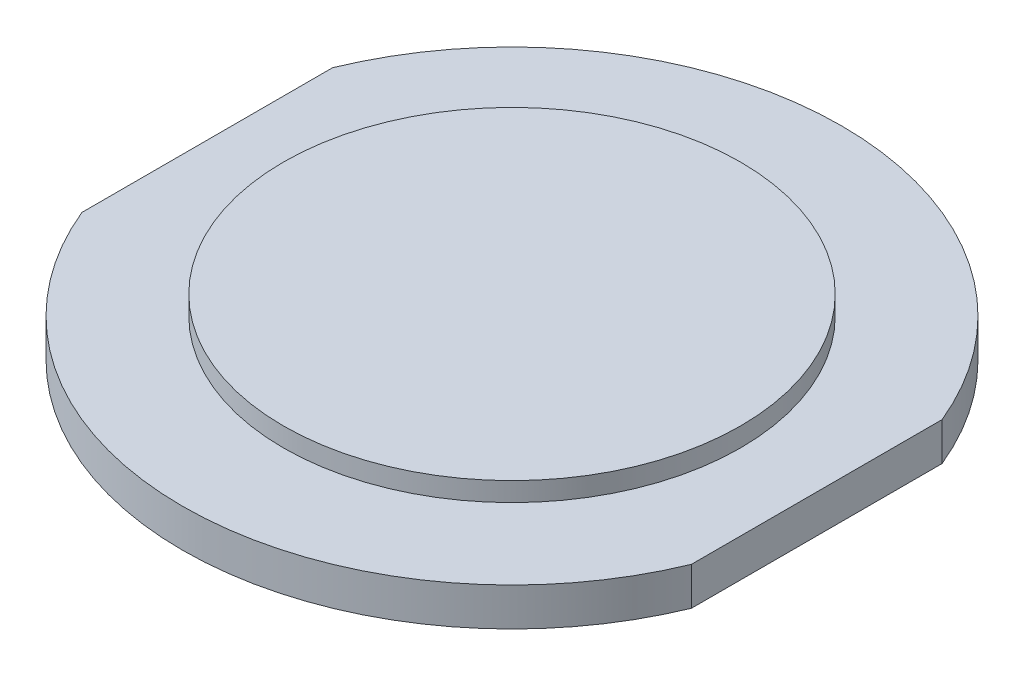
from build123d import *

# Parameters (mm, degrees)
SKETCH1_R                = 12
BOSS_EXTRUDE1_DEPTH      = 2
BOSS_EXTRUDE2_DEPTH      = 1
BOSS_EXTRUDE2_DEPTH_BACK = 2
SKETCH2_R                = 12


with BuildPart() as part:
    # Sketch1 → Boss-Extrude1 (new body)
    with BuildSketch(Plane(origin=(0, 0, 0), x_dir=(1, 0, 0), z_dir=(0, 1, 0))):
        with BuildLine():
            Line((-16, 6.57951366), (-16, -6.57951366))
            ThreePointArc((-16, -6.57951366), (0, -17.3), (16, -6.57951366))
            Line((16, -6.57951366), (16, 6.57951366))
            ThreePointArc((16, 6.57951366), (0, 17.3), (-16, 6.57951366))
        make_face()
        Circle(SKETCH1_R, mode=Mode.SUBTRACT)
    extrude(amount=BOSS_EXTRUDE1_DEPTH)

    # Sketch2 → Boss-Extrude2 (add, two sides: drawn at the far end of the back side and taken through both)
    with BuildSketch(Plane(origin=(0, 2, 0), x_dir=(1, 0, 0), z_dir=(0, 1, 0)).offset(-BOSS_EXTRUDE2_DEPTH_BACK)):
        Circle(SKETCH2_R)
    extrude(amount=BOSS_EXTRUDE2_DEPTH + BOSS_EXTRUDE2_DEPTH_BACK)


solid = part.part
